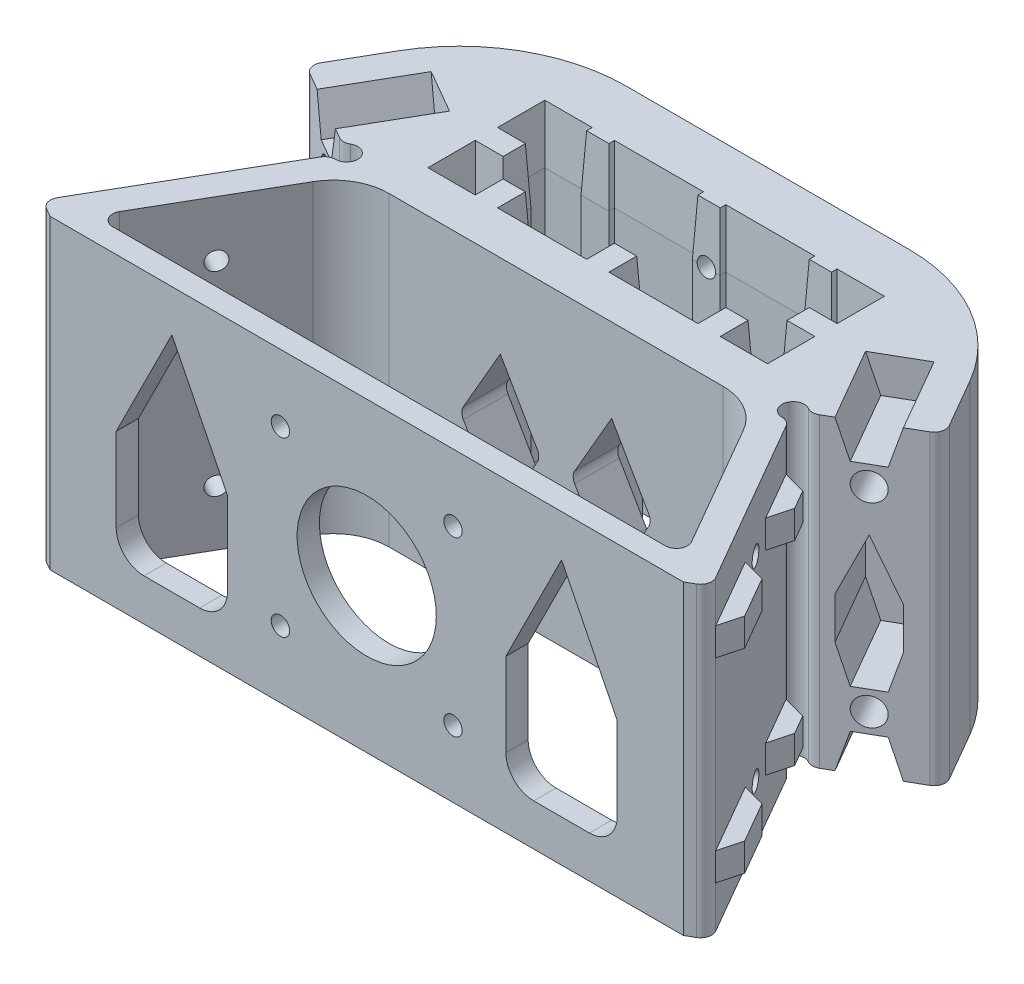
from build123d import *

# Parameters (mm, degrees)
BOSS_EXTRUDE1_DEPTH      = 55
SKETCH13_R               = 5
CUT_EXTRUDE7_DEPTH       = 106.913479808
SKETCH14_R               = 5
SKETCH14_R_2             = 2.5
BOSS_EXTRUDE8_DEPTH      = 16
CUT_EXTRUDE8_DEPTH       = 15
SKETCH16_W               = 14.535898385
SKETCH16_H               = 5
SKETCH16_W_2             = 10
BOSS_EXTRUDE9_DEPTH      = 3
CHAMFER2_SIZE            = 3
CUT_EXTRUDE9_REACH       = 121.348
SKETCH17_R               = 1.65
CHAMFER2_OF_MIRROR7_SIZE = 3
CUT_EXTRUDE10_REACH      = 111.206
SKETCH18_R               = 1.65
SKETCH19_R               = 6
CUT_EXTRUDE11_DEPTH      = 4
CUT_EXTRUDE12_REACH      = 91.963
SKETCH22_W               = 113.76755047
SKETCH22_H               = 0.641016151
CUT_EXTRUDE13_DEPTH      = 98.058374232
CUT_EXTRUDE14_REACH      = 110.781
SKETCH23_R               = 12.5
SKETCH23_R_2             = 1.65
FILLET1_R                = 5


with BuildPart() as part:
    # Sketch1 → Boss-Extrude1 (new body)
    with BuildSketch(Plane(origin=(0, 0, 0), x_dir=(1, 0, 0), z_dir=(0, 1, 0))):
        with BuildLine():
            Line((55.773502692, -52.641016151), (58.371578903, -51.141016151))
            ThreePointArc((58.371578903, -51.141016151), (59.303430556, -49.926603434), (59.103629711, -48.408965344))
            Line((59.103629711, -48.408965344), (41.835680518, -18.5))
            ThreePointArc((41.835680518, -18.5), (41.103629711, -17.767949192), (40.103629711, -17.5))
            ThreePointArc((40.103629711, -17.5), (38.171778058, -14.98236191), (41.103629711, -13.767949192))
            ThreePointArc((41.103629711, -13.767949192), (42.103629711, -14.035898385), (43.103629711, -13.767949192))
            Line((43.103629711, -13.767949192), (55.692086979, -6.5))
            ThreePointArc((55.692086979, -6.5), (56.623938632, -5.285587283), (56.424137787, -3.767949192))
            Line((56.424137787, -3.767949192), (51.36195996, 5))
            ThreePointArc((51.36195996, 5), (40.381197846, 15.980762114), (25.381197846, 20))
            Line((25.381197846, 20), (-25.381197846, 20))
            ThreePointArc((-25.381197846, 20), (-40.381197846, 15.980762114), (-51.36195996, 5))
            Line((-51.36195996, 5), (-56.424137787, -3.767949192))
            ThreePointArc((-56.424137787, -3.767949192), (-56.623938632, -5.285587283), (-55.692086979, -6.5))
            Line((-55.692086979, -6.5), (-43.103629711, -13.767949192))
            ThreePointArc((-43.103629711, -13.767949192), (-42.103629711, -14.035898385), (-41.103629711, -13.767949192))
            ThreePointArc((-41.103629711, -13.767949192), (-38.171778058, -14.98236191), (-40.103629711, -17.5))
            ThreePointArc((-40.103629711, -17.5), (-41.103629711, -17.767949192), (-41.835680518, -18.5))
            Line((-41.835680518, -18.5), (-59.103629711, -48.408965344))
            ThreePointArc((-59.103629711, -48.408965344), (-59.303430556, -49.926603434), (-58.371578903, -51.141016151))
            Line((-58.371578903, -51.141016151), (-55.773502692, -52.641016151))
            Line((-55.773502692, -52.641016151), (-55.692086979, -52.5))
            ThreePointArc((-55.692086979, -52.5), (-55.326061575, -52.133974596), (-54.826061575, -52))
            Line((-54.826061575, -52), (54.826061575, -52))
            ThreePointArc((54.826061575, -52), (55.326061575, -52.133974596), (55.692086979, -52.5))
            Line((55.692086979, -52.5), (55.773502692, -52.641016151))
        make_face()
        with BuildLine():
            Line((-30, -18), (30, -18))
            ThreePointArc((30, -18), (35, -19.339745962), (38.660254038, -23))
            Line((38.660254038, -23), (51.36195996, -45))
            ThreePointArc((51.36195996, -45), (51.36195996, -47), (49.629909152, -48))
            Line((49.629909152, -48), (-49.629909152, -48))
            ThreePointArc((-49.629909152, -48), (-51.36195996, -47), (-51.36195996, -45))
            Line((-51.36195996, -45), (-38.660254038, -23))
            ThreePointArc((-38.660254038, -23), (-35, -19.339745962), (-30, -18))
        make_face(mode=Mode.SUBTRACT)
        Polygon((-30, 10), (-22.5, 10), (-22.5, 9), (-17.5, 9), (-17.5, 10), (-2.5, 10), (-2.5, 9), (2.5, 9), (2.5, 10), (17.5, 10), (17.5, 9), (22.5, 9), (22.5, 10), (30, 10), (30, 2.5), (25, 2.5), (25, -2.5), (30, -2.5), (30, -10), (22.5, -10), (22.5, -5), (17.5, -5), (17.5, -10), (2.5, -10), (2.5, -5), (-2.5, -5), (-2.5, -10), (-17.5, -10), (-17.5, -5), (-22.5, -5), (-22.5, -10), (-30, -10), (-30, -2.5), (-25, -2.5), (-25, 2.5), (-30, 2.5), align=None, mode=Mode.SUBTRACT)
    extrude(amount=BOSS_EXTRUDE1_DEPTH)

    # Sketch13 → Cut-Extrude7 (cut, through all)
    with BuildSketch(Plane(origin=(16.737604307, 0, 28.990381057), x_dir=(0.8660254037844353, 0, -0.500000000000006), z_dir=(0.500000000000006, 0, 0.8660254037844353))):
        with Locations((36.980762114, 10)):
            Circle(SKETCH13_R)
        with Locations((36.980762114, 45)):
            Circle(SKETCH13_R)
    cut_extrude7 = extrude(amount=-CUT_EXTRUDE7_DEPTH, mode=Mode.SUBTRACT)

    # Sketch14 → Boss-Extrude8 (add)
    # profile 1 of 2: a face of its own
    with BuildSketch(Plane(origin=(16.737604307, 0, 28.990381057), x_dir=(0.8660254037844353, 0, -0.500000000000006), z_dir=(0.500000000000006, 0, 0.8660254037844353))):
        with Locations((36.980762114, 45)):
            Circle(SKETCH14_R)
        with Locations((36.980762114, 45)):
            Circle(SKETCH14_R_2, mode=Mode.SUBTRACT)
    # profile 2 of 2: a face of its own
    with BuildSketch(Plane(origin=(16.737604307, 0, 28.990381057), x_dir=(0.8660254037844353, 0, -0.500000000000006), z_dir=(0.500000000000006, 0, 0.8660254037844353))):
        with Locations((36.980762114, 10)):
            Circle(SKETCH14_R)
        with Locations((36.980762114, 10)):
            Circle(SKETCH14_R_2, mode=Mode.SUBTRACT)
    boss_extrude8 = extrude(amount=-BOSS_EXTRUDE8_DEPTH)

    # Sketch15 → Cut-Extrude8 (cut)
    with BuildSketch(Plane(origin=(16.737604307, 0, 28.990381057), x_dir=(0.8660254037844353, 0, -0.500000000000006), z_dir=(0.500000000000006, 0, 0.8660254037844353))):
        Polygon((32.480762114, 55), (34.480762114, 48.5), (39.480762114, 48.5), (41.480762114, 55), align=None)
        Polygon((39.480762114, 6.5), (41.480762114, 0), (32.480762114, 0), (34.480762114, 6.5), align=None)
        Polygon((41.480762114, 20), (41.480762114, 27.5), (36.980762114, 37.5), (32.480762114, 27.5), (32.480762114, 20), (34.480762114, 13.5), (39.480762114, 13.5), align=None)
    cut_extrude8 = extrude(amount=-CUT_EXTRUDE8_DEPTH, mode=Mode.SUBTRACT)

    # Sketch16 → Boss-Extrude9 (add)
    with BuildSketch(Plane(origin=(23.366025404, 0, -13.490381057), x_dir=(-0.5000000000000017, 0, -0.8660254037844377), z_dir=(0.8660254037844377, 0, -0.5000000000000017))):
        with Locations((-64.207259421, 10)):
            Rectangle(SKETCH16_W, SKETCH16_H)
        with Locations((-41.939310229, 10)):
            Rectangle(SKETCH16_W_2, SKETCH16_H)
        with Locations((-64.207259421, 45)):
            Rectangle(SKETCH16_W, SKETCH16_H)
        with Locations((-41.939310229, 45)):
            Rectangle(SKETCH16_W_2, SKETCH16_H)
    boss_extrude9 = extrude(amount=BOSS_EXTRUDE9_DEPTH)

    # Chamfer2
    chamfer2_edges = [part.edges().sort_by_distance(p)[0] for p in [
        (44.43375673, 45, 17),
        (44.43375673, 10, 17),
        (49.43375673, 10, 25.660254038),
        (49.43375673, 45, 25.660254038),
        (54.43375673, 45, 34.320508076),
        (54.43375673, 10, 34.320508076),
        (61.701705922, 10, 46.908965344),
        (61.701705922, 45, 46.908965344),
    ]]
    chamfer(chamfer2_edges, length=CHAMFER2_SIZE - 0.0001)  # a hair under: the kernel refuses the full size

    # Sketch17 → Cut-Extrude9 (cut, up to next)
    with BuildSketch(Plane(origin=(23.366025404, 0, -13.490381057), x_dir=(-0.5000000000000017, 0, -0.8660254037844377), z_dir=(0.8660254037844377, 0, -0.5000000000000017)), mode=Mode.PRIVATE) as cut_extrude9_sk1:
        with Locations((-51.939310229, 10)):
            Circle(SKETCH17_R)
    cut_extrude9_tool1 = extrude(cut_extrude9_sk1.sketch, amount=-CUT_EXTRUDE9_REACH, mode=Mode.PRIVATE) & part.part
    # Sketch17 → Cut-Extrude9 (cut, up to next)
    with BuildSketch(Plane(origin=(23.366025404, 0, -13.490381057), x_dir=(-0.5000000000000017, 0, -0.8660254037844377), z_dir=(0.8660254037844377, 0, -0.5000000000000017)), mode=Mode.PRIVATE) as cut_extrude9_sk2:
        with Locations((-51.939310229, 45)):
            Circle(SKETCH17_R)
    cut_extrude9_tool2 = extrude(cut_extrude9_sk2.sketch, amount=-CUT_EXTRUDE9_REACH, mode=Mode.PRIVATE) & part.part
    cut_extrude9_1 = cut_extrude9_tool1.solids().sort_by_distance((49.335681, 10, 31.490381))[0]
    add(cut_extrude9_1, mode=Mode.SUBTRACT)
    cut_extrude9_2 = cut_extrude9_tool2.solids().sort_by_distance((49.335681, 45, 31.490381))[0]
    add(cut_extrude9_2, mode=Mode.SUBTRACT)
    cut_extrude9 = cut_extrude9_1 + cut_extrude9_2  # Cut-Extrude9 as one shape, for the pattern or mirror that repeats it

    # Mirror7: Cut-Extrude7, Boss-Extrude8, Cut-Extrude8, Boss-Extrude9, Cut-Extrude9 across plane
    add(cut_extrude7.mirror(Plane(origin=(0, 0, 0), x_dir=(0, 0, 1), z_dir=(1, 0, 0))), mode=Mode.SUBTRACT)
    add(boss_extrude8.mirror(Plane(origin=(0, 0, 0), x_dir=(0, 0, 1), z_dir=(1, 0, 0))))
    add(cut_extrude8.mirror(Plane(origin=(0, 0, 0), x_dir=(0, 0, 1), z_dir=(1, 0, 0))), mode=Mode.SUBTRACT)
    add(boss_extrude9.mirror(Plane(origin=(0, 0, 0), x_dir=(0, 0, 1), z_dir=(1, 0, 0))))
    add(cut_extrude9.mirror(Plane(origin=(0, 0, 0), x_dir=(0, 0, 1), z_dir=(1, 0, 0))), mode=Mode.SUBTRACT)

    # Chamfer2 of Mirror7
    chamfer2_of_mirror7_edges = [part.edges().sort_by_distance(p)[0] for p in [
        (-44.43375673, 45, 17),
        (-44.43375673, 10, 17),
        (-49.43375673, 10, 25.660254038),
        (-49.43375673, 45, 25.660254038),
        (-54.43375673, 45, 34.320508076),
        (-54.43375673, 10, 34.320508076),
        (-61.701705922, 10, 46.908965344),
        (-61.701705922, 45, 46.908965344),
    ]]
    chamfer(chamfer2_of_mirror7_edges, length=CHAMFER2_OF_MIRROR7_SIZE - 0.0001)  # a hair under: the kernel refuses the full size

    # Sketch18 → Cut-Extrude10 (cut, up to next)
    with BuildSketch(Plane(origin=(0, 0, -20), x_dir=(-1, 0, 0), z_dir=(0, 0, -1)), mode=Mode.PRIVATE) as cut_extrude10_sk1:
        with Locations((0, 45)):
            Circle(SKETCH18_R)
    cut_extrude10_tool1 = extrude(cut_extrude10_sk1.sketch, amount=-CUT_EXTRUDE10_REACH, mode=Mode.PRIVATE) & part.part
    # Sketch18 → Cut-Extrude10 (cut, up to next)
    with BuildSketch(Plane(origin=(0, 0, -20), x_dir=(-1, 0, 0), z_dir=(0, 0, -1)), mode=Mode.PRIVATE) as cut_extrude10_sk2:
        with Locations((0, 10)):
            Circle(SKETCH18_R)
    cut_extrude10_tool2 = extrude(cut_extrude10_sk2.sketch, amount=-CUT_EXTRUDE10_REACH, mode=Mode.PRIVATE) & part.part
    # Sketch18 → Cut-Extrude10 (cut, up to next)
    with BuildSketch(Plane(origin=(0, 0, -20), x_dir=(-1, 0, 0), z_dir=(0, 0, -1)), mode=Mode.PRIVATE) as cut_extrude10_sk3:
        with Locations((-20, 27.5)):
            Circle(SKETCH18_R)
    cut_extrude10_tool3 = extrude(cut_extrude10_sk3.sketch, amount=-CUT_EXTRUDE10_REACH, mode=Mode.PRIVATE) & part.part
    # Sketch18 → Cut-Extrude10 (cut, up to next)
    with BuildSketch(Plane(origin=(0, 0, -20), x_dir=(-1, 0, 0), z_dir=(0, 0, -1)), mode=Mode.PRIVATE) as cut_extrude10_sk4:
        with Locations((20, 27.5)):
            Circle(SKETCH18_R)
    cut_extrude10_tool4 = extrude(cut_extrude10_sk4.sketch, amount=-CUT_EXTRUDE10_REACH, mode=Mode.PRIVATE) & part.part
    add(cut_extrude10_tool1.solids().sort_by_distance((0, 45, -20))[0], mode=Mode.SUBTRACT)
    add(cut_extrude10_tool2.solids().sort_by_distance((0, 10, -20))[0], mode=Mode.SUBTRACT)
    add(cut_extrude10_tool3.solids().sort_by_distance((20, 27.5, -20))[0], mode=Mode.SUBTRACT)
    add(cut_extrude10_tool4.solids().sort_by_distance((-20, 27.5, -20))[0], mode=Mode.SUBTRACT)

    # Sketch19 → Cut-Extrude11 (cut)
    with BuildSketch(Plane(origin=(0, 0, -20), x_dir=(-1, 0, 0), z_dir=(0, 0, -1))):
        with Locations((0, 45)):
            Circle(SKETCH19_R)
        with Locations(Location((20, 27.5, 0), (0, 0, 26.250833445))):
            Circle(SKETCH19_R)
        with Locations((0, 10)):
            Circle(SKETCH19_R)
        with Locations(Location((-20, 27.5, 0), (0, 0, 206.250833445))):
            Circle(SKETCH19_R)
    extrude(amount=-CUT_EXTRUDE11_DEPTH, mode=Mode.SUBTRACT)

    # Sketch20 → Cut-Extrude12 (cut, up to next)
    with BuildSketch(Plane.XY.offset(18), mode=Mode.PRIVATE) as cut_extrude12_sk1:
        with BuildLine():
            Line((-10, 40), (-16.639528096, 28.5))
            ThreePointArc((-16.639528096, 28.5), (-16.907477288, 27.5), (-16.639528096, 26.5))
            Line((-16.639528096, 26.5), (-11.732050808, 18))
            ThreePointArc((-11.732050808, 18), (-10, 17), (-8.267949192, 18))
            Line((-8.267949192, 18), (-3.360471904, 26.5))
            ThreePointArc((-3.360471904, 26.5), (-3.092522712, 27.5), (-3.360471904, 28.5))
            Line((-3.360471904, 28.5), (-10, 40))
        make_face()
    cut_extrude12_tool1 = extrude(cut_extrude12_sk1.sketch, amount=-CUT_EXTRUDE12_REACH, mode=Mode.PRIVATE) & part.part
    # Sketch20 → Cut-Extrude12 (cut, up to next)
    with BuildSketch(Plane.XY.offset(18), mode=Mode.PRIVATE) as cut_extrude12_sk2:
        with BuildLine():
            Line((3.360471904, 28.5), (10, 40))
            Line((10, 40), (16.639528096, 28.5))
            ThreePointArc((16.639528096, 28.5), (16.907477288, 27.5), (16.639528096, 26.5))
            Line((16.639528096, 26.5), (11.732050808, 18))
            ThreePointArc((11.732050808, 18), (10, 17), (8.267949192, 18))
            Line((8.267949192, 18), (3.360471904, 26.5))
            ThreePointArc((3.360471904, 26.5), (3.092522712, 27.5), (3.360471904, 28.5))
        make_face()
    cut_extrude12_tool2 = extrude(cut_extrude12_sk2.sketch, amount=-CUT_EXTRUDE12_REACH, mode=Mode.PRIVATE) & part.part
    add(cut_extrude12_tool1.solids().sort_by_distance((-10, 27.670453, 18))[0], mode=Mode.SUBTRACT)
    add(cut_extrude12_tool2.solids().sort_by_distance((10, 27.670453, 18))[0], mode=Mode.SUBTRACT)

    # Sketch22 → Cut-Extrude13 (cut, through all)
    with BuildSketch(Plane(origin=(0, 55, 0), x_dir=(1, 0, 0), z_dir=(0, 1, 0))):
        with Locations((0, -52.320508076)):
            Rectangle(SKETCH22_W, SKETCH22_H)
    extrude(amount=-CUT_EXTRUDE13_DEPTH, mode=Mode.SUBTRACT)

    # Sketch23 → Cut-Extrude14 (cut, up to next)
    with BuildSketch(Plane.XY.offset(52), mode=Mode.PRIVATE) as cut_extrude14_sk1:
        with Locations((0, 27.5)):
            Circle(SKETCH23_R)
    cut_extrude14_tool1 = extrude(cut_extrude14_sk1.sketch, amount=-CUT_EXTRUDE14_REACH, mode=Mode.PRIVATE) & part.part
    # Sketch23 → Cut-Extrude14 (cut, up to next)
    with BuildSketch(Plane.XY.offset(52), mode=Mode.PRIVATE) as cut_extrude14_sk2:
        with Locations((-15.5, 12)):
            Circle(SKETCH23_R_2)
    cut_extrude14_tool2 = extrude(cut_extrude14_sk2.sketch, amount=-CUT_EXTRUDE14_REACH, mode=Mode.PRIVATE) & part.part
    # Sketch23 → Cut-Extrude14 (cut, up to next)
    with BuildSketch(Plane.XY.offset(52), mode=Mode.PRIVATE) as cut_extrude14_sk3:
        with Locations((15.5, 12)):
            Circle(SKETCH23_R_2)
    cut_extrude14_tool3 = extrude(cut_extrude14_sk3.sketch, amount=-CUT_EXTRUDE14_REACH, mode=Mode.PRIVATE) & part.part
    # Sketch23 → Cut-Extrude14 (cut, up to next)
    with BuildSketch(Plane.XY.offset(52), mode=Mode.PRIVATE) as cut_extrude14_sk4:
        with Locations((15.5, 43)):
            Circle(SKETCH23_R_2)
    cut_extrude14_tool4 = extrude(cut_extrude14_sk4.sketch, amount=-CUT_EXTRUDE14_REACH, mode=Mode.PRIVATE) & part.part
    # Sketch23 → Cut-Extrude14 (cut, up to next)
    with BuildSketch(Plane.XY.offset(52), mode=Mode.PRIVATE) as cut_extrude14_sk5:
        with Locations((-15.5, 43)):
            Circle(SKETCH23_R_2)
    cut_extrude14_tool5 = extrude(cut_extrude14_sk5.sketch, amount=-CUT_EXTRUDE14_REACH, mode=Mode.PRIVATE) & part.part
    # Sketch23 → Cut-Extrude14 (cut, up to next)
    with BuildSketch(Plane.XY.offset(52), mode=Mode.PRIVATE) as cut_extrude14_sk6:
        Polygon((35, 47.5), (45, 27.5), (45, 7.5), (25, 7.5), (25, 27.5), align=None)
    cut_extrude14_tool6 = extrude(cut_extrude14_sk6.sketch, amount=-CUT_EXTRUDE14_REACH, mode=Mode.PRIVATE) & part.part
    # Sketch23 → Cut-Extrude14 (cut, up to next)
    with BuildSketch(Plane.XY.offset(52), mode=Mode.PRIVATE) as cut_extrude14_sk7:
        Polygon((-45, 27.5), (-45, 7.5), (-25, 7.5), (-25, 27.5), (-35, 47.5), align=None)
    cut_extrude14_tool7 = extrude(cut_extrude14_sk7.sketch, amount=-CUT_EXTRUDE14_REACH, mode=Mode.PRIVATE) & part.part
    add(cut_extrude14_tool1.solids().sort_by_distance((0, 27.5, 52))[0], mode=Mode.SUBTRACT)
    add(cut_extrude14_tool2.solids().sort_by_distance((-15.5, 12, 52))[0], mode=Mode.SUBTRACT)
    add(cut_extrude14_tool3.solids().sort_by_distance((15.5, 12, 52))[0], mode=Mode.SUBTRACT)
    add(cut_extrude14_tool4.solids().sort_by_distance((15.5, 43, 52))[0], mode=Mode.SUBTRACT)
    add(cut_extrude14_tool5.solids().sort_by_distance((-15.5, 43, 52))[0], mode=Mode.SUBTRACT)
    add(cut_extrude14_tool6.solids().sort_by_distance((35, 23.055556, 52))[0], mode=Mode.SUBTRACT)
    add(cut_extrude14_tool7.solids().sort_by_distance((-35, 23.055556, 52))[0], mode=Mode.SUBTRACT)

    # Fillet1
    fillet1_edges = [part.edges().sort_by_distance(p)[0] for p in [
        (45, 7.5, 50),
        (25, 7.5, 50),
        (-25, 7.5, 50),
        (-45, 7.5, 50),
    ]]
    fillet(fillet1_edges, radius=FILLET1_R)

    # Chamfer3: read off the stored shape, not the designer's step
    # Chamfer3: loft between two sections, ruled curve by curve
    chamfer3_from = [
        Edge.make_line((30, 45, 10), (30, 45, 2.5)),
        Edge.make_line((30, 45, -2.5), (30, 45, -10)),
        Edge.make_line((30, 45, 2.5), (25, 45, 2.5)),
        Edge.make_line((-30, 45, 2.5), (-25, 45, 2.5)),
        Edge.make_line((30, 45, 10), (22.5, 45, 10)),
        Edge.make_line((17.5, 45, 10), (2.5, 45, 10)),
        Edge.make_line((-2.5, 45, 10), (-17.5, 45, 10)),
        Edge.make_line((-22.5, 45, 10), (-30, 45, 10)),
        Edge.make_line((25, 45, 2.5), (25, 45, -2.5)),
        Edge.make_line((22.5, 45, 10), (22.5, 45, 5)),
        Edge.make_line((22.5, 45, -10), (22.5, 45, -9)),
        Edge.make_line((25, 45, -2.5), (30, 45, -2.5)),
        Edge.make_line((-25, 45, -2.5), (-30, 45, -2.5)),
        Edge.make_line((22.5, 45, 5), (17.5, 45, 5)),
        Edge.make_line((2.5, 45, 5), (-2.5, 45, 5)),
        Edge.make_line((-17.5, 45, 5), (-22.5, 45, 5)),
        Edge.make_line((17.5, 45, 5), (17.5, 45, 10)),
        Edge.make_line((17.5, 45, -9), (17.5, 45, -10)),
        Edge.make_line((30, 45, -10), (22.5, 45, -10)),
        Edge.make_line((17.5, 45, -10), (2.5, 45, -10)),
        Edge.make_line((-2.5, 45, -10), (-17.5, 45, -10)),
        Edge.make_line((-22.5, 45, -10), (-30, 45, -10)),
        Edge.make_line((2.5, 45, 10), (2.5, 45, 5)),
        Edge.make_line((2.5, 45, -10), (2.5, 45, -9)),
        Edge.make_line((22.5, 45, -9), (17.5, 45, -9)),
        Edge.make_line((-17.5, 45, -9), (-22.5, 45, -9)),
        Edge.make_line((-2.5, 45, 5), (-2.5, 45, 10)),
        Edge.make_line((-2.5, 45, -9), (-2.5, 45, -10)),
        Edge.make_line((-17.5, 45, 10), (-17.5, 45, 5)),
        Edge.make_line((-17.5, 45, -10), (-17.5, 45, -9)),
        Edge.make_line((-22.5, 45, 5), (-22.5, 45, 10)),
        Edge.make_line((-22.5, 45, -9), (-22.5, 45, -10)),
        Edge.make_line((-30, 45, 10), (-30, 45, 2.5)),
        Edge.make_line((-30, 45, -10), (-30, 45, -2.5)),
        Edge.make_line((-25, 45, 2.5), (-25, 45, -2.5)),
        Edge.make_line((-2.5, 45, -9), (2.5, 45, -9)),
    ]
    chamfer3_to = [
        Edge.make_line((30.5, 55, 10.5), (30.5, 55, 2)),
        Edge.make_line((30.5, 55, -2), (30.5, 55, -10.5)),
        Edge.make_line((30.5, 55, 2), (25.5, 55, 2)),
        Edge.make_line((-30.5, 55, 2), (-25.5, 55, 2)),
        Edge.make_line((30.5, 55, 10.5), (22, 55, 10.5)),
        Edge.make_line((18, 55, 10.5), (2, 55, 10.5)),
        Edge.make_line((-2, 55, 10.5), (-18, 55, 10.5)),
        Edge.make_line((-22, 55, 10.5), (-30.5, 55, 10.5)),
        Edge.make_line((25.5, 55, 2), (25.5, 55, -2)),
        Edge.make_line((22, 55, 10.5), (22, 55, 5.5)),
        Edge.make_line((22, 55, -10.5), (22, 55, -9.5)),
        Edge.make_line((25.5, 55, -2), (30.5, 55, -2)),
        Edge.make_line((-25.5, 55, -2), (-30.5, 55, -2)),
        Edge.make_line((22, 55, 5.5), (18, 55, 5.5)),
        Edge.make_line((2, 55, 5.5), (-2, 55, 5.5)),
        Edge.make_line((-18, 55, 5.5), (-22, 55, 5.5)),
        Edge.make_line((18, 55, 5.5), (18, 55, 10.5)),
        Edge.make_line((18, 55, -9.5), (18, 55, -10.5)),
        Edge.make_line((30.5, 55, -10.5), (22, 55, -10.5)),
        Edge.make_line((18, 55, -10.5), (2, 55, -10.5)),
        Edge.make_line((-2, 55, -10.5), (-18, 55, -10.5)),
        Edge.make_line((-22, 55, -10.5), (-30.5, 55, -10.5)),
        Edge.make_line((2, 55, 10.5), (2, 55, 5.5)),
        Edge.make_line((2, 55, -10.5), (2, 55, -9.5)),
        Edge.make_line((22, 55, -9.5), (18, 55, -9.5)),
        Edge.make_line((-18, 55, -9.5), (-22, 55, -9.5)),
        Edge.make_line((-2, 55, 5.5), (-2, 55, 10.5)),
        Edge.make_line((-2, 55, -9.5), (-2, 55, -10.5)),
        Edge.make_line((-18, 55, 10.5), (-18, 55, 5.5)),
        Edge.make_line((-18, 55, -10.5), (-18, 55, -9.5)),
        Edge.make_line((-22, 55, 5.5), (-22, 55, 10.5)),
        Edge.make_line((-22, 55, -9.5), (-22, 55, -10.5)),
        Edge.make_line((-30.5, 55, 10.5), (-30.5, 55, 2)),
        Edge.make_line((-30.5, 55, -10.5), (-30.5, 55, -2)),
        Edge.make_line((-25.5, 55, 2), (-25.5, 55, -2)),
        Edge.make_line((-2, 55, -9.5), (2, 55, -9.5)),
    ]
    chamfer3 = Solid(Shell([*[Face.make_surface_from_curves(chamfer3_from[k], chamfer3_to[k]) for k in range(36)], Face(Wire(chamfer3_from)), Face(Wire(chamfer3_to))]))
    add(chamfer3, mode=Mode.SUBTRACT)


solid = part.part
